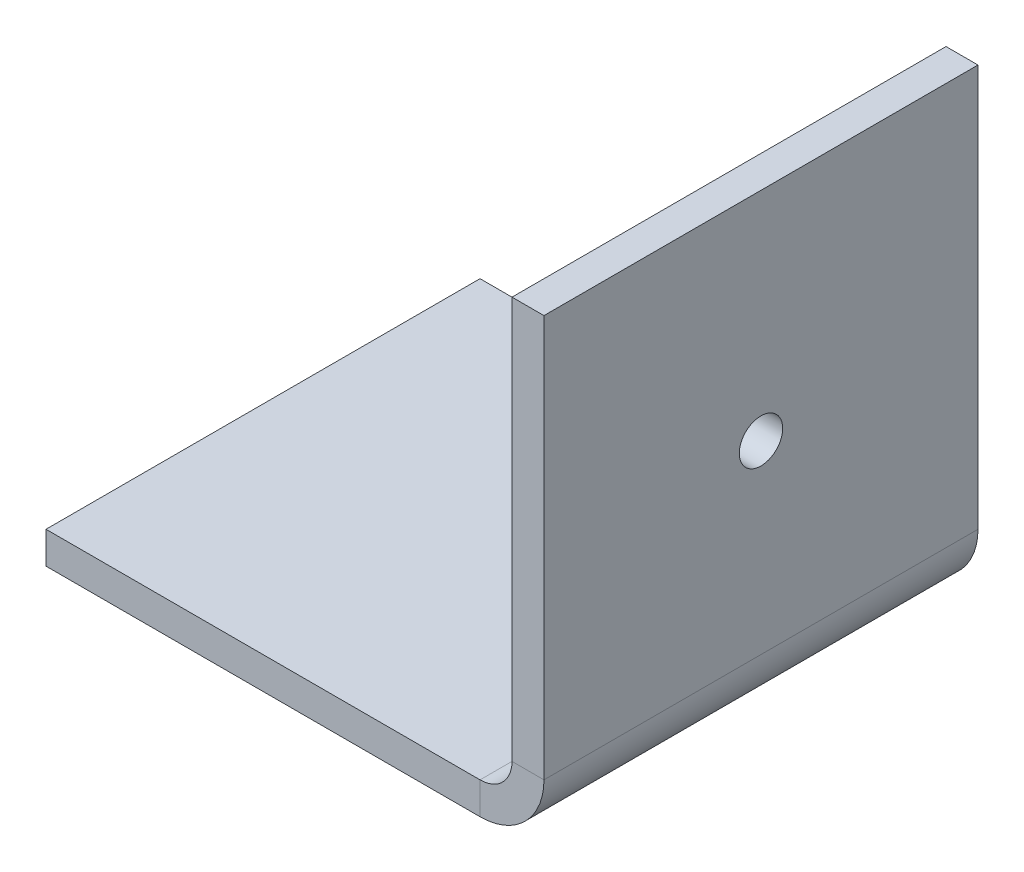
from build123d import *

# Parameters (mm, degrees)
SKETCH1_W               = 10
SKETCH1_H               = 10
BASE_FLANGE1_DEPTH      = 0.7366
EDGE_FLANGE1_DEPTH      = 10
EDGE_FLANGE1_START      = 0.7366
EDGE_FLANGE1_PROFILE_W  = 10
EDGE_FLANGE1_PROFILE_H  = 9.2634
EDGE_FLANGE1_PROFILE_R  = 0.5
EDGE_FLANGE1_FLAT_DEPTH = 0.7366


# Sheet-metal steps are written as plain solids
with BuildPart() as part:
    # Sketch1 → Base-Flange1 (new body)
    with BuildSketch(Plane(origin=(0, 0, 0), x_dir=(1, 0, 0), z_dir=(0, 1, 0))):
        Rectangle(SKETCH1_W, SKETCH1_H)
    extrude(amount=-BASE_FLANGE1_DEPTH)

    # Edge-Flange1 bend section (across the edge) → Edge-Flange1 (add)
    with BuildSketch(Plane(origin=(5.7366, 0, 5), x_dir=(-1, 0, 0), z_dir=(0, 0, -1))):
        with BuildLine():
            Line((-0.7366, 0.7366), (0, 0.7366))
            ThreePointArc((0, 0.7366), (0.215745145, 0.215745145), (0.7366, 0))
            Line((0.7366, 0), (0.7366, -0.7366))
            ThreePointArc((0.7366, -0.7366), (-0.30510971, -0.30510971), (-0.7366, 0.7366))
        make_face()
    extrude(amount=EDGE_FLANGE1_DEPTH)

    # Edge-Flange1 profile (on flange) → Edge-Flange1 flat (add)
    with BuildSketch(Plane(origin=(5.7366, 0, 0), x_dir=(0, 0, -1), z_dir=(1, 0, 0)).offset(EDGE_FLANGE1_START)):
        with Locations((0, 5.3683)):
            Rectangle(EDGE_FLANGE1_PROFILE_W, EDGE_FLANGE1_PROFILE_H)
        with Locations((0, 5)):
            Circle(EDGE_FLANGE1_PROFILE_R, mode=Mode.SUBTRACT)
    extrude(amount=-EDGE_FLANGE1_FLAT_DEPTH)


solid = part.part
